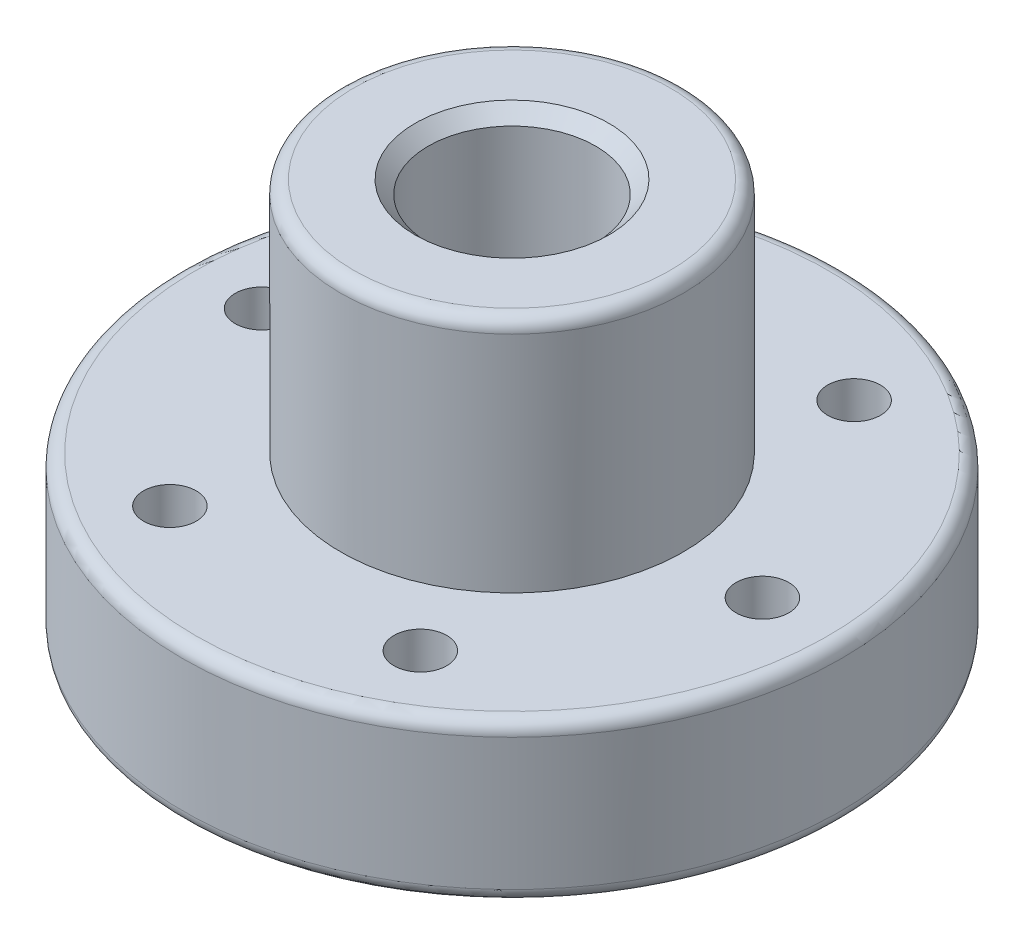
from build123d import *

# Parameters (mm, degrees)
ESQUISSE3_R                  = 1
ENL_V_MAT_EXTRU_1_DEPTH      = 20.836834425
R_P_TITION_CIRCULAIRE1_COUNT = 6
CONG_1_R                     = 0.5
CHANFREIN1_SIZE              = 0.5


with BuildPart() as part:
    # Esquisse1 → Révolution2 (revolve)
    with BuildSketch(Plane.XY):
        Polygon((6.5, 15), (6.5, 6), (12.5, 6), (12.5, 0), (3.175, 0), (3.175, 15), align=None)
    revolve(axis=Axis((0, 0, 0), (0, 1, 0)))

    # Esquisse3 → Enlèv. mat.-Extru.1 (cut, through all)
    with BuildSketch(Plane(origin=(0, 6, 0), x_dir=(1, 0, 0), z_dir=(0, 1, 0))):
        with Locations((9.5, 0)):
            Circle(ESQUISSE3_R)
    enl_v_mat_extru_1 = extrude(amount=-ENL_V_MAT_EXTRU_1_DEPTH, mode=Mode.SUBTRACT)

    # Répétition circulaire1: Enlèv. mat.-Extru.1 ×6 about axis
    r_p_tition_circulaire1_axis = Axis((0, 0, 0), (0, -1, 0))
    for i in range(1, R_P_TITION_CIRCULAIRE1_COUNT):
        add(enl_v_mat_extru_1.rotate(r_p_tition_circulaire1_axis, i * 360 / R_P_TITION_CIRCULAIRE1_COUNT), mode=Mode.SUBTRACT)

    # Congé1
    cong_1_edges = [part.edges().sort_by_distance(p)[0] for p in [
        (-6.5, 15, 0),
        (-12.5, 0, 0),
        (-12.5, 6, 0),
    ]]
    fillet(cong_1_edges, radius=CONG_1_R)

    # Chanfrein1
    chanfrein1_edges = [part.edges().sort_by_distance(p)[0] for p in [
        (-3.175, 0, 0),
        (-3.175, 15, 0),
    ]]
    chamfer(chanfrein1_edges, length=CHANFREIN1_SIZE)


solid = part.part
